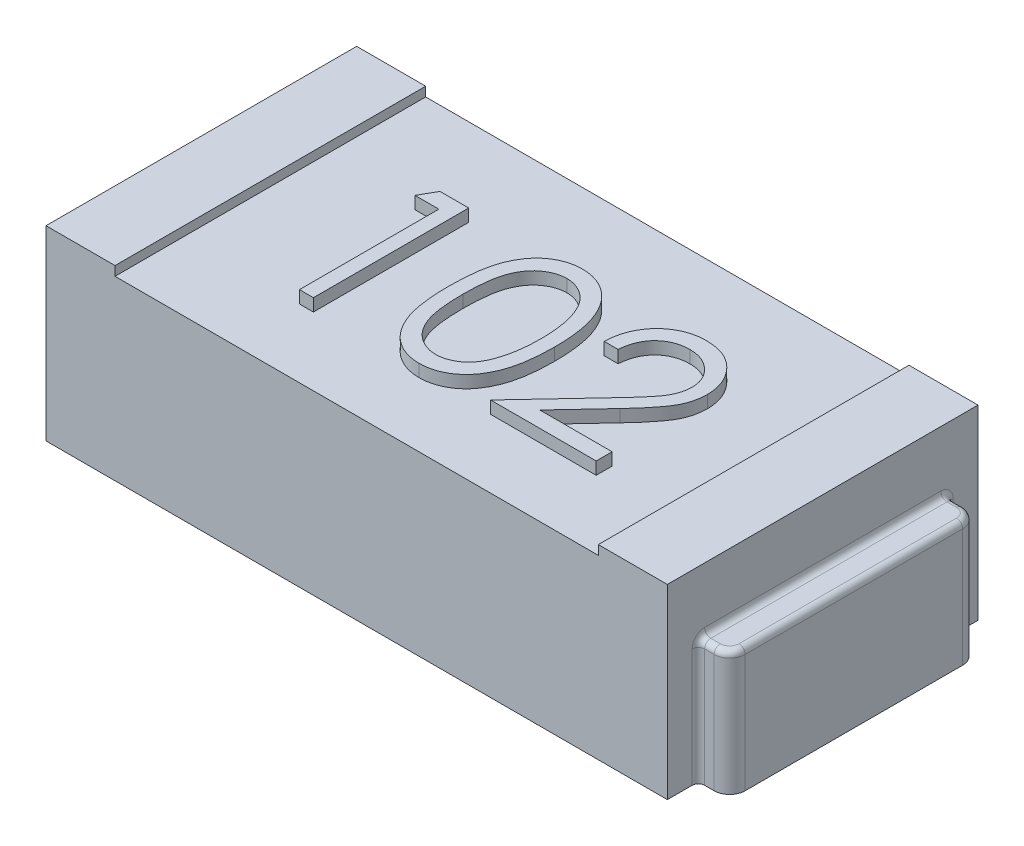
from build123d import *

# Parameters (mm, degrees)
ESQUISSE1_W             = 2
ESQUISSE1_H             = 1
BOSS_EXTRU_1_DEPTH      = 0.6
ESQUISSE2_W             = 1.555645222
ESQUISSE2_H             = 1
ENL_V_MAT_EXTRU_1_DEPTH = 0.03
BOSS_EXTRU_2_DEPTH      = 0.4
CONG_1_R                = 0.02
CONG_1_OF_SYM_TRIE2_R   = 0.02
BOSS_EXTRU_3_DEPTH      = 0.04


with BuildPart() as part:
    # Esquisse1 → Boss.-Extru.1 (new body)
    with BuildSketch(Plane(origin=(0, 0, 0), x_dir=(1, 0, 0), z_dir=(0, 1, 0))):
        Rectangle(ESQUISSE1_W, ESQUISSE1_H)
    extrude(amount=BOSS_EXTRU_1_DEPTH)

    # Esquisse2 → Enlèv. mat.-Extru.1 (cut)
    with BuildSketch(Plane(origin=(0, 0.6, 0), x_dir=(1, 0, 0), z_dir=(0, 1, 0))):
        Rectangle(ESQUISSE2_W, ESQUISSE2_H)
    extrude(amount=-ENL_V_MAT_EXTRU_1_DEPTH, mode=Mode.SUBTRACT)

    # Esquisse3 → Boss.-Extru.2 (add)
    with BuildSketch(Plane(origin=(0, 0, 0), x_dir=(1, 0, 0), z_dir=(0, 1, 0))):
        with BuildLine():
            Line((1, 0.4), (1.050552667, 0.4))
            ThreePointArc((1.050552667, 0.4), (1.085908006, 0.385355339), (1.100552667, 0.35))
            Line((1.100552667, 0.35), (1.100552667, -0.35))
            ThreePointArc((1.100552667, -0.35), (1.085908006, -0.385355339), (1.050552667, -0.4))
            Line((1.050552667, -0.4), (1, -0.4))
            Line((1, -0.4), (1, 0.4))
        make_face()
    boss_extru_2 = extrude(amount=BOSS_EXTRU_2_DEPTH)

    # Congé1
    cong_1_edges = [part.edges().sort_by_distance(p)[0] for p in [
        (1, 0.2, -0.4),
        (1, 0.2, 0.4),
        (1.025276334, 0.4, -0.4),
        (1.085908006, 0.4, -0.385355339),
        (1.100552667, 0.4, 0),
        (1.085908006, 0.4, 0.385355339),
        (1.025276334, 0.4, 0.4),
        (1, 0.4, 0),
    ]]
    fillet(cong_1_edges, radius=CONG_1_R)

    # Symétrie2: Boss.-Extru.2 across plane
    add(boss_extru_2.mirror(Plane(origin=(0, 0, 0), x_dir=(0, 0, 1), z_dir=(1, 0, 0))))

    # Congé1 of Symétrie2
    cong_1_of_sym_trie2_edges = [part.edges().sort_by_distance(p)[0] for p in [
        (-1, 0.2, -0.4),
        (-1, 0.2, 0.4),
        (-1.025276334, 0.4, -0.4),
        (-1.085908006, 0.4, -0.385355339),
        (-1.100552667, 0.4, 0),
        (-1.085908006, 0.4, 0.385355339),
        (-1.025276334, 0.4, 0.4),
        (-1, 0.4, 0),
    ]]
    fillet(cong_1_of_sym_trie2_edges, radius=CONG_1_OF_SYM_TRIE2_R)

    # Esquisse4 → Boss.-Extru.3 (add)
    # profile 1 of 3: a face of its own
    with BuildSketch(Plane(origin=(0, 0.57, 0), x_dir=(1, 0, 0), z_dir=(0, 1, 0))):
        with BuildLine():
            Line((0.275641026, 0.065854324), (0.230769231, 0.065854324))
            add(Edge.make_bspline(
                [(0.230769231, 0.065854324), (0.231061681, 0.071807307), (0.231636046, 0.08349881), (0.234325802, 0.100545082), (0.238174498, 0.116838625), (0.243616135, 0.132248612), (0.250374174, 0.146911299), (0.258478464, 0.160768444), (0.268077586, 0.173767185), (0.278964262, 0.18578702), (0.290788353, 0.196813816), (0.303546344, 0.206335994), (0.316952777, 0.214381375), (0.330966977, 0.221107267), (0.345747057, 0.226155816), (0.361158894, 0.229901765), (0.377270199, 0.232155528), (0.388247345, 0.232397784), (0.393830128, 0.23252099)],
                knots=[0, 0, 0, 0, 1.10065271, 2.161652631, 3.183658789, 4.190468796, 5.17591951, 6.163126047, 7.15150782, 8.156236427, 9.156009102, 10.134482811, 11.092018607, 12.041330605, 13.001268258, 13.972401359, 14.968799086, 16, 16, 16, 16], degree=3))
            add(Edge.make_bspline(
                [(0.393830128, 0.23252099), (0.39931271, 0.232392639), (0.410085788, 0.232140434), (0.425808933, 0.229974573), (0.440777118, 0.226582346), (0.454961085, 0.221823), (0.468247665, 0.215425225), (0.480736672, 0.207739862), (0.492576787, 0.198851315), (0.503234899, 0.188386485), (0.513021768, 0.177214715), (0.521464947, 0.165287872), (0.528695399, 0.152969403), (0.53472221, 0.140165374), (0.539158802, 0.126755227), (0.542527117, 0.112934198), (0.544431033, 0.098559225), (0.544723237, 0.088829717), (0.544871795, 0.08388317)],
                knots=[0, 0, 0, 0, 1.111607364, 2.184268762, 3.212621178, 4.221274766, 5.211760367, 6.196651075, 7.1921475, 8.207485113, 9.220403448, 10.201281604, 11.166441695, 12.114753415, 13.065576456, 14.026450734, 14.996634279, 16, 16, 16, 16], degree=3))
            add(Edge.make_bspline(
                [(0.544871795, 0.08388317), (0.5446299, 0.076919193), (0.544150356, 0.063113449), (0.540048302, 0.042825611), (0.533641657, 0.023169408), (0.525927749, 0.007349794), (0.518145972, -0.005397848), (0.511133471, -0.015893378), (0.502924212, -0.027194159), (0.493398712, -0.03926235), (0.482754016, -0.052192479), (0.470893707, -0.065976736), (0.45773321, -0.080472703), (0.448496281, -0.090373503), (0.443709936, -0.09550385)],
                knots=[0, 0, 0, 0, 1.184426356, 2.348067706, 3.509069118, 4.696110526, 5.333549288, 6.050745305, 6.844228056, 7.710549037, 8.667450064, 9.695053472, 10.805634456, 12, 12, 12, 12], degree=3))
            Line((0.443709936, -0.09550385), (0.318609776, -0.229017471))
            Line((0.318609776, -0.229017471), (0.551282051, -0.229017471))
            Line((0.551282051, -0.229017471), (0.551282051, -0.280299523))
            Line((0.551282051, -0.280299523), (0.211538462, -0.280299523))
            Line((0.211538462, -0.280299523), (0.405448718, -0.073368433))
            add(Edge.make_bspline(
                [(0.405448718, -0.073368433), (0.410169845, -0.068440103), (0.419238163, -0.058973791), (0.432064245, -0.045153368), (0.443584101, -0.032332005), (0.4538723, -0.020533927), (0.462705658, -0.00958656), (0.470544548, 0.000155541), (0.476825347, 0.009120462), (0.483641832, 0.019511978), (0.490243829, 0.032199452), (0.495917023, 0.047704265), (0.499376287, 0.063665301), (0.499791263, 0.074451306), (0.5, 0.079876759)],
                knots=[0, 0, 0, 0, 1.329631726, 2.553950428, 3.673215718, 4.687767853, 5.603093632, 6.413772471, 7.123043292, 7.734684054, 8.834405432, 9.900288307, 10.943827018, 12, 12, 12, 12], degree=3))
            add(Edge.make_bspline(
                [(0.5, 0.079876759), (0.49990918, 0.083288388), (0.49973019, 0.090012052), (0.498150519, 0.099870018), (0.495763304, 0.109379277), (0.492342553, 0.11856908), (0.487827304, 0.12734703), (0.482331107, 0.135723813), (0.47598967, 0.143822236), (0.468653774, 0.151415565), (0.460594985, 0.158370023), (0.452081521, 0.164530606), (0.443074363, 0.169679051), (0.433611489, 0.17389955), (0.423719279, 0.177210319), (0.413378601, 0.179504402), (0.402618027, 0.180944757), (0.395270385, 0.181139638), (0.391526442, 0.181238939)],
                knots=[0, 0, 0, 0, 0.991446411, 1.95395049, 2.89581595, 3.838931463, 4.798493298, 5.75982156, 6.748411868, 7.785213223, 8.824556874, 9.840280684, 10.836137867, 11.835679398, 12.848801643, 13.863922112, 14.911575587, 16, 16, 16, 16], degree=3))
            add(Edge.make_bspline(
                [(0.391526442, 0.181238939), (0.387616323, 0.181136791), (0.379937495, 0.180936191), (0.368663348, 0.179532953), (0.357908237, 0.177112119), (0.347645108, 0.173801165), (0.337856595, 0.169592801), (0.328590303, 0.164351123), (0.319867034, 0.158096338), (0.311670387, 0.15100483), (0.30411839, 0.143109459), (0.297483122, 0.134308036), (0.291685406, 0.124761262), (0.286626944, 0.114494898), (0.282518988, 0.103415786), (0.279379967, 0.091563257), (0.276896132, 0.078988774), (0.276066343, 0.07030519), (0.275641026, 0.065854324)],
                knots=[0, 0, 0, 0, 1.031018746, 2.02475058, 2.990194455, 3.934040569, 4.864654155, 5.795059489, 6.735614925, 7.690564532, 8.649604399, 9.611025574, 10.590972636, 11.591080095, 12.624614302, 13.701020113, 14.821632451, 16, 16, 16, 16], degree=3))
        make_face()
    # profile 2 of 3: a face of its own
    with BuildSketch(Plane(origin=(0, 0.57, 0), x_dir=(1, 0, 0), z_dir=(0, 1, 0))):
        with BuildLine():
            add(Edge.make_bspline(
                [(-0.173076923, -0.030499843), (-0.173030063, -0.022485931), (-0.172939038, -0.00691879), (-0.171926406, 0.01576473), (-0.170244214, 0.037044772), (-0.167938875, 0.056922352), (-0.16513345, 0.075402605), (-0.16138838, 0.092436141), (-0.157129408, 0.108101799), (-0.152193345, 0.122450663), (-0.14662366, 0.13567605), (-0.140561623, 0.148022507), (-0.133766653, 0.159471354), (-0.126627094, 0.170205324), (-0.11885394, 0.180048709), (-0.110668399, 0.189140518), (-0.101750988, 0.197270626), (-0.092404844, 0.20467724), (-0.082545349, 0.211170022), (-0.07245354, 0.216888984), (-0.062059953, 0.22177468), (-0.051336213, 0.225616171), (-0.040378704, 0.228789149), (-0.029149123, 0.230958998), (-0.017628929, 0.232324271), (-0.009853009, 0.232454795), (-0.005909455, 0.23252099)],
                knots=[0, 0, 0, 0, 1.646270934, 3.197905019, 4.663502075, 6.030701355, 7.308322542, 8.50163776, 9.611534131, 10.641858119, 11.616356847, 12.558055219, 13.465016945, 14.349605745, 15.204443733, 16.039544428, 16.859896111, 17.680448484, 18.487036065, 19.28249412, 20.06191084, 20.843045899, 21.620316918, 22.403196591, 23.190181807, 24, 24, 24, 24], degree=3))
            add(Edge.make_bspline(
                [(-0.005909455, 0.23252099), (-0.001932958, 0.232451302), (0.005975043, 0.232312715), (0.017666525, 0.230980723), (0.029087908, 0.228770563), (0.0401905, 0.225638995), (0.051065498, 0.221753898), (0.061627842, 0.21688431), (0.071943139, 0.211215901), (0.081847466, 0.204555347), (0.091449554, 0.197129307), (0.100513548, 0.18873464), (0.109040275, 0.179456109), (0.117136747, 0.169392986), (0.124573261, 0.158352259), (0.13165518, 0.146525958), (0.137994042, 0.133707263), (0.144098996, 0.120110053), (0.149368565, 0.105358102), (0.154120886, 0.089534565), (0.157960739, 0.072452538), (0.161159206, 0.054201646), (0.163637048, 0.034714862), (0.165441712, 0.01403396), (0.16639501, -0.007854667), (0.166574538, -0.022820074), (0.166666667, -0.030499843)],
                knots=[0, 0, 0, 0, 0.810914788, 1.612654377, 2.396697861, 3.181598691, 3.963628158, 4.749916497, 5.551656086, 6.361998678, 7.18212741, 8.025565596, 8.878627764, 9.750805457, 10.657531673, 11.591944965, 12.560506719, 13.57287815, 14.630710178, 15.753379473, 16.941251878, 18.199788006, 19.531962791, 20.947069417, 22.433333509, 24, 24, 24, 24], degree=3))
            add(Edge.make_bspline(
                [(0.166666667, -0.030499843), (0.166573583, -0.038146116), (0.166392214, -0.053044566), (0.165452398, -0.074834705), (0.163601165, -0.095405854), (0.161285453, -0.114807349), (0.158078172, -0.132958437), (0.154134577, -0.14992193), (0.14975596, -0.165771083), (0.144350989, -0.180376056), (0.138435173, -0.193940588), (0.131998717, -0.206607324), (0.125103027, -0.218488222), (0.117590349, -0.229488186), (0.109582719, -0.239685137), (0.100908749, -0.248899083), (0.091812951, -0.257352037), (0.082182606, -0.264873698), (0.072123813, -0.271457241), (0.061843945, -0.277344934), (0.051160605, -0.282092462), (0.040315897, -0.286168896), (0.029154702, -0.289283247), (0.017690932, -0.291436655), (0.005982898, -0.292946919), (-0.001931611, -0.29306213), (-0.005909455, -0.293120035)],
                knots=[0, 0, 0, 0, 1.561518951, 3.042555995, 4.452378317, 5.7783523, 7.031515105, 8.214008947, 9.334062868, 10.386615937, 11.391082383, 12.354592575, 13.286541444, 14.194233754, 15.072674879, 15.931287219, 16.775624067, 17.606195743, 18.42308326, 19.229000347, 20.022332153, 20.807536673, 21.593273796, 22.3848459, 23.188221202, 24, 24, 24, 24], degree=3))
            add(Edge.make_bspline(
                [(-0.005909455, -0.293120035), (-0.0098529, -0.293053413), (-0.017628604, -0.292922047), (-0.029150379, -0.291562943), (-0.040333585, -0.289377871), (-0.051233407, -0.286318356), (-0.061905766, -0.282573379), (-0.072205236, -0.277694282), (-0.082246333, -0.272075129), (-0.09200227, -0.265675783), (-0.101289721, -0.258344114), (-0.110160951, -0.25023493), (-0.118393096, -0.241145871), (-0.12605511, -0.231220454), (-0.133337123, -0.22054999), (-0.140035605, -0.208988794), (-0.146231441, -0.196582707), (-0.151894797, -0.183251577), (-0.156916034, -0.168800873), (-0.161351421, -0.153065276), (-0.164853444, -0.135905899), (-0.167851009, -0.117460561), (-0.170268778, -0.09765), (-0.171919396, -0.07646346), (-0.172939583, -0.053914145), (-0.173030308, -0.038447034), (-0.173076923, -0.030499843)],
                knots=[0, 0, 0, 0, 0.810891512, 1.598919785, 2.382837074, 3.152667961, 3.926044502, 4.706494248, 5.493654104, 6.291793342, 7.103789334, 7.925228297, 8.761435821, 9.622817696, 10.50288917, 11.416980706, 12.369136599, 13.353924996, 14.394355917, 15.514179734, 16.714354668, 17.994756427, 19.357759367, 20.818452758, 22.365282078, 24, 24, 24, 24], degree=3))
        make_face()
        with BuildLine():
            add(Edge.make_bspline(
                [(-0.128205128, -0.030299523), (-0.128188064, -0.036977908), (-0.128154947, -0.049939343), (-0.127289775, -0.068774095), (-0.126111171, -0.086341285), (-0.124590985, -0.102663218), (-0.122333421, -0.117684649), (-0.11980388, -0.131508889), (-0.116725582, -0.14406278), (-0.113083436, -0.155432467), (-0.108934994, -0.165810906), (-0.104405585, -0.175468222), (-0.099539767, -0.184518499), (-0.094094174, -0.192880443), (-0.088163451, -0.200581323), (-0.081881557, -0.207757442), (-0.075014045, -0.214157011), (-0.06551351, -0.221832276), (-0.052971157, -0.229763581), (-0.037168234, -0.236670165), (-0.020929884, -0.241010516), (-0.009908277, -0.241562481), (-0.004407051, -0.241837984)],
                knots=[0, 0, 0, 0, 1.459021318, 2.831673884, 4.118529203, 5.306027144, 6.411944654, 7.436330062, 8.375795394, 9.233974572, 10.042671642, 10.816086306, 11.563610507, 12.285937304, 12.993564865, 13.685989202, 14.367179055, 15.041617293, 16.353048772, 17.594441528, 18.799311195, 20, 20, 20, 20], degree=3))
            add(Edge.make_bspline(
                [(-0.004407051, -0.241837984), (0.001129759, -0.24160973), (0.012191948, -0.241153692), (0.028353919, -0.236753873), (0.044043957, -0.230115367), (0.056339949, -0.222265723), (0.065694598, -0.214790248), (0.072397025, -0.208416726), (0.078548746, -0.201280174), (0.084383328, -0.193580275), (0.089734625, -0.18516992), (0.094600787, -0.176089552), (0.099041266, -0.166313955), (0.101571129, -0.159489707), (0.102864583, -0.156000644)],
                knots=[0, 0, 0, 0, 1.353760809, 2.704726607, 4.075137775, 5.516104923, 6.260822281, 7.007110065, 7.778089737, 8.566572457, 9.372053459, 10.217411131, 11.088608312, 12, 12, 12, 12], degree=3))
            add(Edge.make_bspline(
                [(0.102864583, -0.156000644), (0.104371979, -0.151539253), (0.107432638, -0.142480715), (0.111377177, -0.128428765), (0.114483663, -0.113685513), (0.117278429, -0.098339068), (0.119186009, -0.082276253), (0.12072141, -0.06554677), (0.121625794, -0.048138004), (0.121737902, -0.036310148), (0.121794872, -0.030299523)],
                knots=[0, 0, 0, 0, 0.884706709, 1.796334032, 2.740027952, 3.714592787, 4.726048262, 5.777819803, 6.87074269, 8, 8, 8, 8], degree=3))
            add(Edge.make_bspline(
                [(0.121794872, -0.030299523), (0.121716273, -0.024289869), (0.121562518, -0.012533703), (0.120974805, 0.00468318), (0.119457152, 0.021035717), (0.117771564, 0.036594356), (0.115286246, 0.051272971), (0.11260656, 0.065194443), (0.109006386, 0.078186304), (0.105160704, 0.090451958), (0.100759219, 0.101852052), (0.095914114, 0.112439736), (0.090739577, 0.122266125), (0.085119257, 0.131304259), (0.079119874, 0.139594623), (0.072583081, 0.146970993), (0.065768171, 0.153661989), (0.056222858, 0.161299499), (0.043726531, 0.169086884), (0.028177153, 0.176253421), (0.011995633, 0.180368891), (0.001056568, 0.180949132), (-0.004407051, 0.181238939)],
                knots=[0, 0, 0, 0, 1.31362396, 2.569729283, 3.763502607, 4.902122613, 5.988968491, 7.01645872, 7.998833611, 8.933434873, 9.825090667, 10.667526885, 11.477055099, 12.250526234, 12.991942729, 13.710640831, 14.402115721, 15.076753259, 16.378508321, 17.609869233, 18.806226677, 20, 20, 20, 20], degree=3))
            add(Edge.make_bspline(
                [(-0.004407051, 0.181238939), (-0.009937136, 0.180948732), (-0.02100738, 0.18036779), (-0.037357087, 0.176268754), (-0.053029138, 0.169124045), (-0.06549242, 0.161273706), (-0.075044389, 0.153796804), (-0.081770488, 0.147313025), (-0.088077084, 0.140220703), (-0.093886756, 0.132449001), (-0.099328082, 0.124096805), (-0.104325369, 0.11509841), (-0.108827845, 0.105408216), (-0.112982779, 0.095034439), (-0.116636034, 0.083665733), (-0.119649458, 0.071127305), (-0.122433322, 0.057347035), (-0.124404075, 0.042244248), (-0.12615604, 0.025918226), (-0.127281947, 0.008307181), (-0.128157841, -0.01055916), (-0.12818905, -0.023587611), (-0.128205128, -0.030299523)],
                knots=[0, 0, 0, 0, 1.207732386, 2.417664972, 3.655092373, 4.956220595, 5.625982001, 6.301752483, 6.994047911, 7.697131622, 8.419323945, 9.170223765, 9.943494443, 10.752040957, 11.610060368, 12.549350801, 13.567764191, 14.679664412, 15.874934091, 17.154273443, 18.533957287, 20, 20, 20, 20], degree=3))
        make_face(mode=Mode.SUBTRACT)
    # profile 3 of 3: a face of its own
    with BuildSketch(Plane(origin=(0, 0.57, 0), x_dir=(1, 0, 0), z_dir=(0, 1, 0))):
        Polygon((-0.451422276, 0.219700477), (-0.358974359, 0.219700477), (-0.358974359, -0.280299523), (-0.403846154, -0.280299523), (-0.403846154, 0.168418426), (-0.480769231, 0.168418426), align=None)
    extrude(amount=BOSS_EXTRU_3_DEPTH)


solid = part.part
